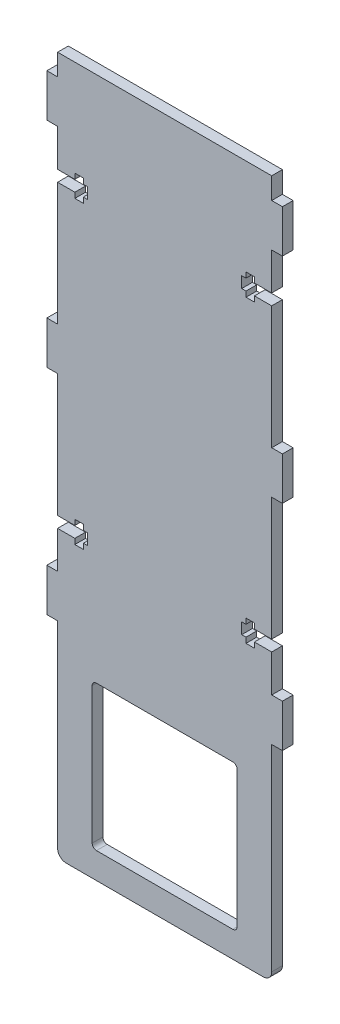
from build123d import *

# Parameters (mm, degrees)
SKETCH1_W           = 63.5
SKETCH1_H           = 152.4
BOSS_EXTRUDE1_DEPTH = 3.175
SKETCH2_W           = 3.175
SKETCH2_H           = 12.7
BOSS_EXTRUDE3_DEPTH = 3.175
SKETCH4_W           = 8.89
SKETCH4_H           = 3.302
SKETCH4_W_2         = 2.5
SKETCH4_H_2         = 6.5
CUT_EXTRUDE4_DEPTH  = 3.175
SKETCH5_W           = 63.5
SKETCH5_H           = 50.8
SKETCH5_W_2         = 43
SKETCH5_H_2         = 43
BOSS_EXTRUDE4_DEPTH = 3.175
SKETCH7_W           = 63.5
SKETCH7_H           = 3.81
BOSS_EXTRUDE5_DEPTH = 3.175
FILLET1_R           = 2.54
FILLET2_R           = 1.27


with BuildPart() as part:
    # Sketch1 → Boss-Extrude1 (new body)
    with BuildSketch(Plane.XY):
        with Locations((31.75, 76.2)):
            Rectangle(SKETCH1_W, SKETCH1_H)
    extrude(amount=BOSS_EXTRUDE1_DEPTH)

    # Sketch2 → Boss-Extrude3 (add)
    with BuildSketch(Plane.XY.offset(3.175)):
        with Locations((-1.5875, 139.7)):
            Rectangle(SKETCH2_W, SKETCH2_H)
        with Locations((-1.5875, 12.7)):
            Rectangle(SKETCH2_W, SKETCH2_H)
        with Locations((-1.5875, 76.2)):
            Rectangle(SKETCH2_W, SKETCH2_H)
        with Locations((65.0875, 12.7)):
            Rectangle(SKETCH2_W, SKETCH2_H)
        with Locations((65.0875, 76.2)):
            Rectangle(SKETCH2_W, SKETCH2_H)
        with Locations((65.0875, 139.7)):
            Rectangle(SKETCH2_W, SKETCH2_H)
    extrude(amount=-BOSS_EXTRUDE3_DEPTH)

    # Sketch4 → Cut-Extrude4 (cut)
    with BuildSketch(Plane.XY.offset(3.175)):
        with Locations((4.445, 120.65)):
            Rectangle(SKETCH4_W, SKETCH4_H)
        with Locations((6.37, 120.65)):
            Rectangle(SKETCH4_W_2, SKETCH4_H_2)
        with Locations((6.37, 31.75)):
            Rectangle(SKETCH4_W_2, SKETCH4_H_2)
        with Locations((4.445, 31.75)):
            Rectangle(SKETCH4_W, SKETCH4_H)
        with Locations((59.055, 31.75)):
            Rectangle(SKETCH4_W, SKETCH4_H)
        with Locations((57.13, 31.75)):
            Rectangle(SKETCH4_W_2, SKETCH4_H_2)
        with Locations((57.13, 120.65)):
            Rectangle(SKETCH4_W_2, SKETCH4_H_2)
        with Locations((59.055, 120.65)):
            Rectangle(SKETCH4_W, SKETCH4_H)
    extrude(amount=-CUT_EXTRUDE4_DEPTH, mode=Mode.SUBTRACT)

    # Sketch5 → Boss-Extrude4 (add)
    with BuildSketch(Plane.XY.offset(3.175)):
        with Locations((31.75, -25.4)):
            Rectangle(SKETCH5_W, SKETCH5_H)
        with Locations((31.75, -25.4)):
            Rectangle(SKETCH5_W_2, SKETCH5_H_2, mode=Mode.SUBTRACT)
    extrude(amount=-BOSS_EXTRUDE4_DEPTH)

    # Sketch7 → Boss-Extrude5 (add)
    with BuildSketch(Plane.XY.offset(3.175)):
        with Locations((31.75, -52.705)):
            Rectangle(SKETCH7_W, SKETCH7_H)
    extrude(amount=-BOSS_EXTRUDE5_DEPTH)

    # Fillet1
    fillet1_edges = [part.edges().sort_by_distance(p)[0] for p in [
        (63.5, -54.61, 1.5875),
        (0, -54.61, 1.5875),
    ]]
    fillet(fillet1_edges, radius=FILLET1_R)

    # Fillet2
    fillet2_edges = [part.edges().sort_by_distance(p)[0] for p in [
        (53.25, -46.9, 1.5875),
        (53.25, -3.9, 1.5875),
        (10.25, -3.9, 1.5875),
        (10.25, -46.9, 1.5875),
    ]]
    fillet(fillet2_edges, radius=FILLET2_R)


solid = part.part
